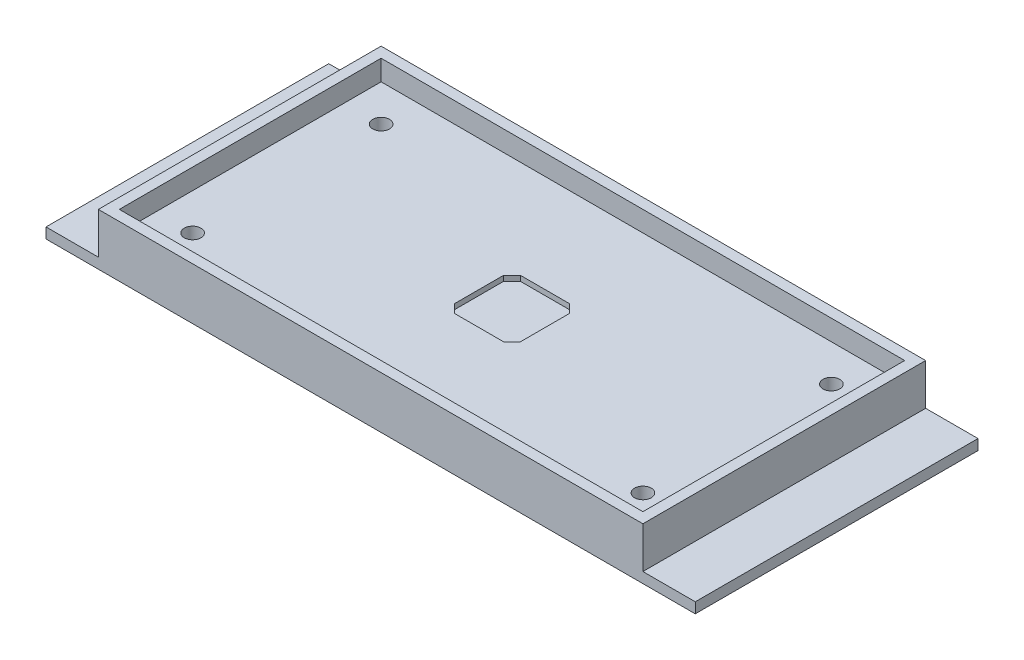
from build123d import *

# Parameters (mm, degrees)
SKETCH2_W           = 5
SKETCH2_H           = 13.5
BOSS_EXTRUDE3_DEPTH = 1
SKETCH2_7_W         = 26
SKETCH2_7_H         = 13.5
BOSS_EXTRUDE6_DEPTH = 4.951
CUT_EXTRUDE2_START  = 4.951
CUT_EXTRUDE2_DEPTH  = 1.951
CUT_EXTRUDE3_START  = 3
CUT_EXTRUDE3_DEPTH  = 0.5
M2_TAPPED_HOLE1_D   = 1.6
BOX_OUTLINE_R       = 0.8
BOX_DEPTH           = 3
BOX_2_OUTLINE_W     = 5
BOX_2_OUTLINE_H     = 13.5
BOX_2_OUTLINE_H_2   = 27
BOX_2_DEPTH         = 1
BOX_START           = 3
BOX_3_DEPTH         = 1.951
BOX_START_2         = 1
BOX_4_DEPTH         = 1.5


# Read off the part's stored shape, not the designer's step: box
with BuildPart() as part:
    # Sketch2 → Boss-Extrude3 (new body)
    with BuildSketch(Plane(origin=(0, 0, 0), x_dir=(1, 0, 0), z_dir=(0, 1, 0))):
        with Locations((28.5, 6.75)):
            Rectangle(SKETCH2_W, SKETCH2_H)
    extrude(amount=BOSS_EXTRUDE3_DEPTH)

    # Sketch2<7> → Boss-Extrude6 (add)
    with BuildSketch(Plane(origin=(0, 0, 0), x_dir=(1, 0, 0), z_dir=(0, 1, 0))):
        with Locations((13, 6.75)):
            Rectangle(SKETCH2_7_W, SKETCH2_7_H)
    extrude(amount=BOSS_EXTRUDE6_DEPTH)

    # Sketch2<9> → Cut-Extrude2 (cut)
    with BuildSketch(Plane(origin=(0, 0, 0), x_dir=(1, 0, 0), z_dir=(0, 1, 0)).offset(CUT_EXTRUDE2_START)):
        Polygon((3.15, 0), (25, 0), (25, 12.5), (0, 12.5), (0, 3.15), (2.35, 3.15), (3.15, 2.35), align=None)
        Polygon((0, 0), (3.15, 0), (3.15, 2.35), (2.35, 3.15), (0, 3.15), align=None)
    extrude(amount=-CUT_EXTRUDE2_DEPTH, mode=Mode.SUBTRACT)

    # Sketch2<12> → Cut-Extrude3 (cut)
    with BuildSketch(Plane(origin=(0, 0, 0), x_dir=(1, 0, 0), z_dir=(0, 1, 0)).offset(CUT_EXTRUDE3_START)):
        Polygon((0, 0), (3.15, 0), (3.15, 2.35), (2.35, 3.15), (0, 3.15), align=None)
    extrude(amount=-CUT_EXTRUDE3_DEPTH, mode=Mode.SUBTRACT)

    # M2 Tapped Hole1 (through all)
    with Locations(Plane(origin=(0, 3, 0), x_dir=(1, 0, 0), z_dir=(0, 1, 0))):
        with Locations((21.5, 9)):
            Hole(M2_TAPPED_HOLE1_D / 2)

    # box outline → box (add)
    with BuildSketch(Plane(origin=(0, 0, 0), x_dir=(1, 0, 0), z_dir=(0, 1, 0))):
        Polygon((-26, -13.5), (26, -13.5), (26, 0), (3.15, 0), (3.15, -2.35), (2.35, -3.15), (-2.35, -3.15), (-3.15, -2.35), (-3.15, 2.35), (-2.35, 3.15), (0, 3.15), (0, 13.5), (-26, 13.5), align=None)
        with Locations((-21.5, -9)):
            Circle(BOX_OUTLINE_R, mode=Mode.SUBTRACT)
        with Locations((21.5, -9)):
            Circle(BOX_OUTLINE_R, mode=Mode.SUBTRACT)
        with Locations((-21.5, 9)):
            Circle(BOX_OUTLINE_R, mode=Mode.SUBTRACT)
    extrude(amount=BOX_DEPTH)

    # box 2 outline → box 2 (add)
    with BuildSketch(Plane(origin=(0, 0, 0), x_dir=(1, 0, 0), z_dir=(0, 1, 0))):
        with Locations((28.5, -6.75)):
            Rectangle(BOX_2_OUTLINE_W, BOX_2_OUTLINE_H)
        with Locations((-28.5, 0)):
            Rectangle(BOX_2_OUTLINE_W, BOX_2_OUTLINE_H_2)
        Polygon((3.15, -2.35), (3.15, 0), (0, 0), (0, 3.15), (-2.35, 3.15), (-3.15, 2.35), (-3.15, -2.35), (-2.35, -3.15), (2.35, -3.15), align=None)
    extrude(amount=BOX_2_DEPTH)

    # box 3 outline → box 3 (add)
    with BuildSketch(Plane(origin=(0, 0, 0), x_dir=(1, 0, 0), z_dir=(0, 1, 0)).offset(BOX_START)):
        Polygon((-26, -13.5), (26, -13.5), (26, 0), (25, 0), (25, -12.5), (-25, -12.5), (-25, 12.5), (0, 12.5), (0, 13.5), (-26, 13.5), align=None)
    extrude(amount=BOX_3_DEPTH)

    # box 4 outline → box 4 (add)
    with BuildSketch(Plane(origin=(0, 0, 0), x_dir=(1, 0, 0), z_dir=(0, 1, 0)).offset(BOX_START_2)):
        Polygon((3.15, -2.35), (3.15, 0), (0, 0), (0, 3.15), (-2.35, 3.15), (-3.15, 2.35), (-3.15, -2.35), (-2.35, -3.15), (2.35, -3.15), align=None)
    extrude(amount=BOX_4_DEPTH)


solid = part.part
